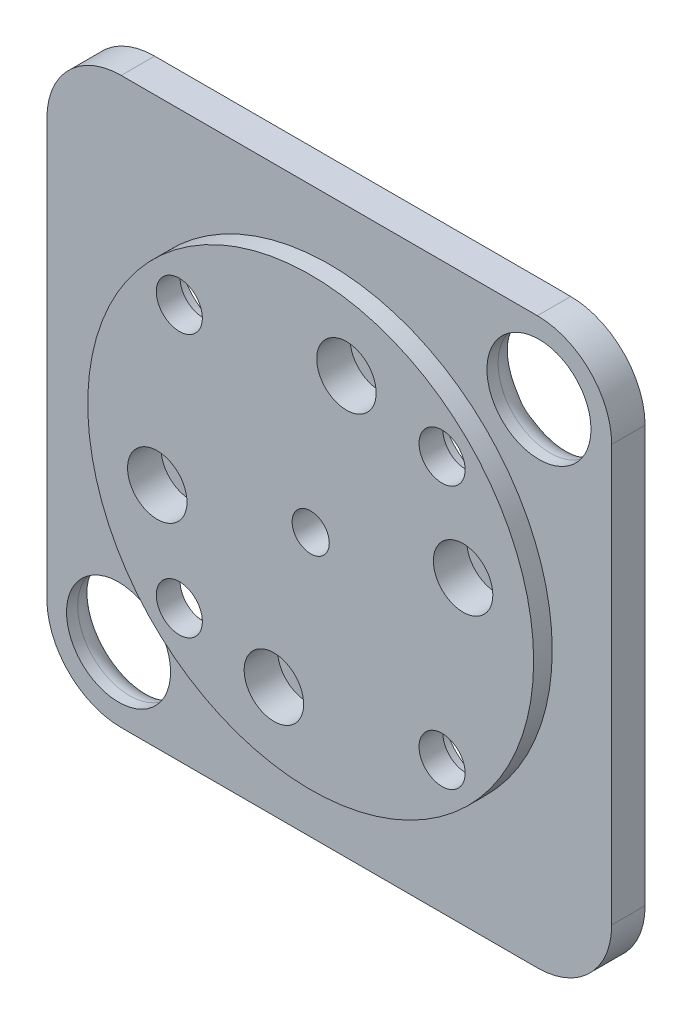
from build123d import *

# Parameters (mm, degrees)
SKETCH1_W           = 76
SKETCH1_H           = 76
BOSS_EXTRUDE1_DEPTH = 4.5
SKETCH2_R           = 3.1
SKETCH2_R_2         = 2.5
SKETCH2_R_3         = 7
SKETCH2_R_4         = 1.575
CUT_EXTRUDE1_DEPTH  = 108.574392864
FILLET1_R           = 10
SKETCH3_R           = 7.25
CUT_EXTRUDE2_DEPTH  = 3.8
SKETCH4_R           = 4
CUT_EXTRUDE3_DEPTH  = 2
FILLET2_R           = 3
BOSS_EXTRUDE2_START = 2.5
SKETCH6_R           = 30
SKETCH6_R_2         = 2.5
SKETCH6_R_3         = 3.1
SKETCH6_R_4         = 4
BOSS_EXTRUDE2_DEPTH = 2.5


with BuildPart() as part:
    # Sketch1 → Boss-Extrude1 (new body)
    with BuildSketch(Plane.XY):
        with Locations((38, 38)):
            Rectangle(SKETCH1_W, SKETCH1_H)
    extrude(amount=BOSS_EXTRUDE1_DEPTH)

    # Sketch2 → Cut-Extrude1 (cut, through all)
    with BuildSketch(Plane.XY.offset(4.5)):
        with Locations((55.67766953, 55.67766953)):
            Circle(SKETCH2_R)
        with Locations((20.32233047, 55.67766953)):
            Circle(SKETCH2_R)
        with Locations((20.32233047, 20.32233047)):
            Circle(SKETCH2_R)
        with Locations((55.67766953, 20.32233047)):
            Circle(SKETCH2_R)
        with Locations((38, 38)):
            Circle(SKETCH2_R_2)
        with Locations((66.213560569, 66.354981926)):
            Circle(SKETCH2_R_3)
        with Locations((42.808326112, 58.647518011)):
            Circle(SKETCH2_R_4)
        with Locations((58.506096654, 42.949747468)):
            Circle(SKETCH2_R_4)
        with Locations((17.352481989, 33.191673888)):
            Circle(SKETCH2_R_4)
        with Locations((9.645018074, 9.786439431)):
            Circle(SKETCH2_R_3)
        with Locations((33.050252532, 17.493903346)):
            Circle(SKETCH2_R_4)
    extrude(amount=-CUT_EXTRUDE1_DEPTH, mode=Mode.SUBTRACT)

    # Fillet1
    fillet1_edges = [part.edges().sort_by_distance(p)[0] for p in [
        (0, 76, 2.25),
        (76, 76, 2.25),
        (76, 0, 2.25),
        (0, 0, 2.25),
    ]]
    fillet(fillet1_edges, radius=FILLET1_R)

    # Sketch3 → Cut-Extrude2 (cut)
    with BuildSketch(Plane(origin=(0, 0, 0), x_dir=(-1, 0, 0), z_dir=(0, 0, -1))):
        with Locations((-55.67766953, 55.67766953)):
            Circle(SKETCH3_R)
        with Locations((-20.32233047, 55.67766953)):
            Circle(SKETCH3_R)
        with Locations((-55.67766953, 20.32233047)):
            Circle(SKETCH3_R)
        with Locations((-20.32233047, 20.32233047)):
            Circle(SKETCH3_R)
    extrude(amount=-CUT_EXTRUDE2_DEPTH, mode=Mode.SUBTRACT)

    # Sketch4 → Cut-Extrude3 (cut)
    with BuildSketch(Plane.XY.offset(4.5)):
        with Locations((58.506096654, 42.949747468)):
            Circle(SKETCH4_R)
        with Locations((33.050252532, 17.493903346)):
            Circle(SKETCH4_R)
        with Locations((17.352481989, 33.191673888)):
            Circle(SKETCH4_R)
        with Locations((42.808326112, 58.647518011)):
            Circle(SKETCH4_R)
    extrude(amount=-CUT_EXTRUDE3_DEPTH, mode=Mode.SUBTRACT)

    # Fillet2
    # the kernel refuses this fillet: 3 mm, written as the material it takes off along each edge
    with BuildSketch(Plane(origin=(66.213560569, 66.354981926, 0), x_dir=(1, 0, 0), z_dir=(0, -1, 0))) as fillet2_piece_1:
        with BuildLine():
            CenterArc((7 + FILLET2_R, FILLET2_R), FILLET2_R, 180, 90)
            Line((7, FILLET2_R), (7, 0))
            Line((7, 0), (7 + FILLET2_R, 0))
        make_face()
    revolve(axis=Axis((66.213560569, 66.354981926, 0), (0, 0, 1)), mode=Mode.SUBTRACT)
    with BuildSketch(Plane(origin=(9.645018074, 9.786439431, 0), x_dir=(1, 0, 0), z_dir=(0, -1, 0))) as fillet2_piece_2:
        with BuildLine():
            CenterArc((7 + FILLET2_R, FILLET2_R), FILLET2_R, 180, 90)
            Line((7, FILLET2_R), (7, 0))
            Line((7, 0), (7 + FILLET2_R, 0))
        make_face()
    revolve(axis=Axis((9.645018074, 9.786439431, 0), (0, 0, 1)), mode=Mode.SUBTRACT)

    # Sketch6 → Boss-Extrude2 (add)
    with BuildSketch(Plane.XY.offset(4.5).offset(BOSS_EXTRUDE2_START)):
        with Locations((38, 38)):
            Circle(SKETCH6_R)
        with Locations((38, 38)):
            Circle(SKETCH6_R_2, mode=Mode.SUBTRACT)
        with Locations((55.67766953, 55.67766953)):
            Circle(SKETCH6_R_3, mode=Mode.SUBTRACT)
        with Locations((55.67766953, 20.32233047)):
            Circle(SKETCH6_R_3, mode=Mode.SUBTRACT)
        with Locations((20.32233047, 55.67766953)):
            Circle(SKETCH6_R_3, mode=Mode.SUBTRACT)
        with Locations((58.506096654, 42.949747468)):
            Circle(SKETCH6_R_4, mode=Mode.SUBTRACT)
        with Locations((42.808326112, 58.647518011)):
            Circle(SKETCH6_R_4, mode=Mode.SUBTRACT)
        with Locations((33.050252532, 17.493903346)):
            Circle(SKETCH6_R_4, mode=Mode.SUBTRACT)
        with Locations((17.352481989, 33.191673888)):
            Circle(SKETCH6_R_4, mode=Mode.SUBTRACT)
        with Locations((20.32233047, 20.32233047)):
            Circle(SKETCH6_R_3, mode=Mode.SUBTRACT)
    extrude(amount=-BOSS_EXTRUDE2_DEPTH)


solid = part.part
